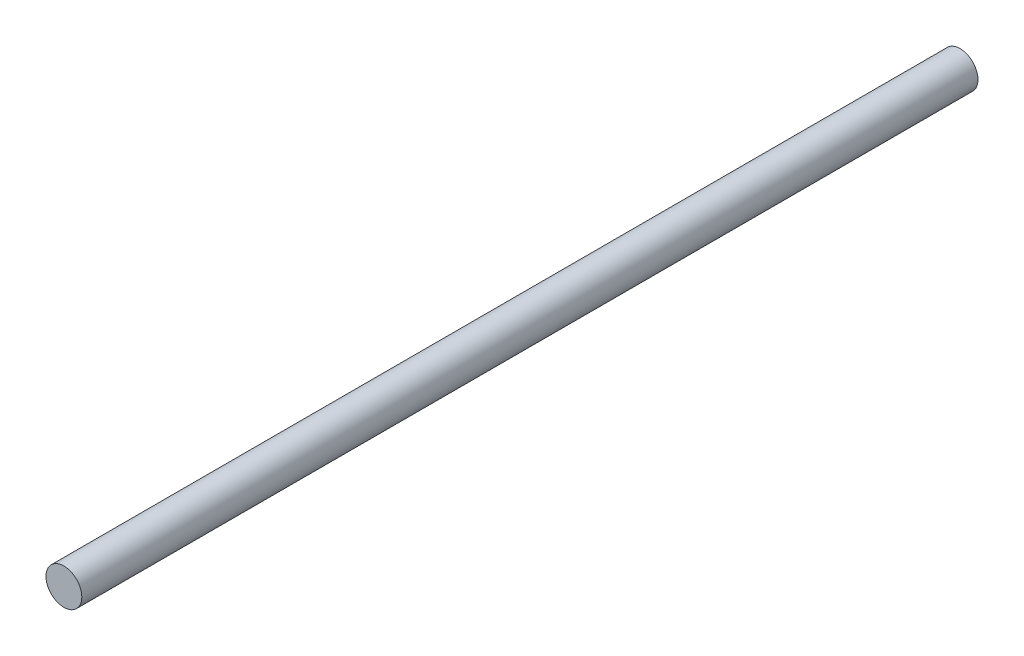
from build123d import *

# Parameters (mm, degrees)
SKIZZE1_R                       = 10
AUFSATZ_LINEAR_AUSTRAGEN1_DEPTH = 500


with BuildPart() as part:
    # Skizze1 → Aufsatz-Linear austragen1 (new body)
    with BuildSketch(Plane.XY):
        Circle(SKIZZE1_R)
    extrude(amount=AUFSATZ_LINEAR_AUSTRAGEN1_DEPTH)


solid = part.part
